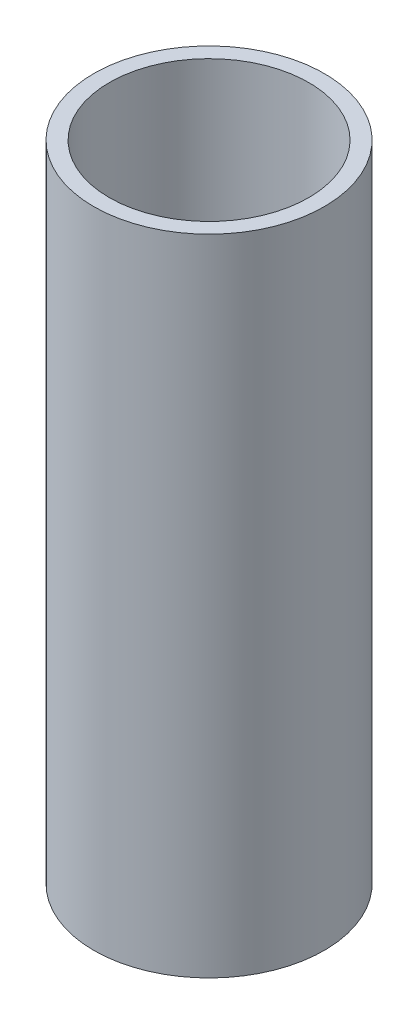
from build123d import *

# Parameters (mm, degrees)
SKETCH1_R           = 30
BOSS_EXTRUDE1_DEPTH = 167.611797927
SKETCH2_R           = 25.948391698
CUT_EXTRUDE1_DEPTH  = 173.89798959


with BuildPart() as part:
    # Sketch1 → Boss-Extrude1 (new body)
    with BuildSketch(Plane(origin=(0, 0, 0), x_dir=(1, 0, 0), z_dir=(0, 1, 0))):
        Circle(SKETCH1_R)
    extrude(amount=BOSS_EXTRUDE1_DEPTH)

    # Sketch2 → Cut-Extrude1 (cut, through all)
    with BuildSketch(Plane(origin=(0, 0, 0), x_dir=(1, 0, 0), z_dir=(0, 1, 0))):
        Circle(SKETCH2_R)
    extrude(amount=CUT_EXTRUDE1_DEPTH, mode=Mode.SUBTRACT)


solid = part.part
